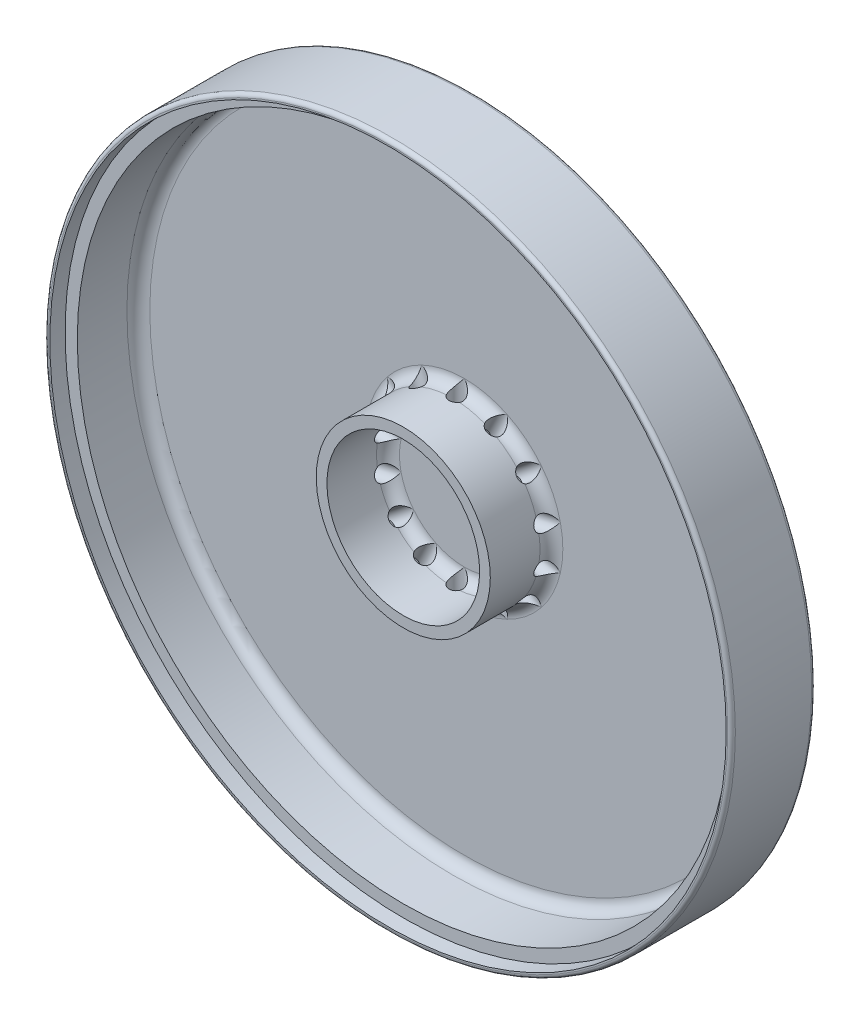
from build123d import *

# Parameters (mm, degrees)
SKETCH1_R                      = 90
SKETCH1_R_2                    = 88.6
SKETCH1_R_3                    = 85.4
SKETCH1_R_4                    = 22.8
SKETCH1_R_5                    = 20
BOSS_EXTRUDE1_DEPTH            = 2
BOSS_EXTRUDE2_START            = 20
SKETCH1_3_R                    = 90
SKETCH1_3_R_2                  = 88.6
BOSS_EXTRUDE2_DEPTH            = 20
BOSS_EXTRUDE3_START            = 16
SKETCH1_4_R                    = 88.6
SKETCH1_4_R_2                  = 85.4
BOSS_EXTRUDE3_DEPTH            = 16
SKETCH1_5_R                    = 22.8
SKETCH1_5_R_2                  = 20
BOSS_EXTRUDE4_DEPTH            = 16
CUT_EXTRUDE3_REACH             = 130.841
SKETCH2_R                      = 2
CUT_EXTRUDE3_DIRECTION_2_REACH = 130.841
FILLET1_R                      = 3
FILLET2_R                      = 3
FILLET3_R                      = 1
FILLET4_R                      = 1
CIRPATTERN1_COUNT              = 7


with BuildPart() as part:
    # Sketch1 → Boss-Extrude1 (new body)
    # profile 1 of 5: a face of its own
    with BuildSketch(Plane.XY):
        Circle(SKETCH1_R)
        Circle(SKETCH1_R_2, mode=Mode.SUBTRACT)
    # profile 2 of 5: a face of its own
    with BuildSketch(Plane.XY):
        Circle(SKETCH1_R_2)
        Circle(SKETCH1_R_3, mode=Mode.SUBTRACT)
    # profile 3 of 5: a face of its own
    with BuildSketch(Plane.XY):
        Circle(SKETCH1_R_3)
        Circle(SKETCH1_R_4, mode=Mode.SUBTRACT)
    # profile 4 of 5: a face of its own
    with BuildSketch(Plane.XY):
        Circle(SKETCH1_R_4)
        Circle(SKETCH1_R_5, mode=Mode.SUBTRACT)
    # profile 5 of 5: a face of its own
    with BuildSketch(Plane.XY):
        Circle(SKETCH1_R_5)
    extrude(amount=-BOSS_EXTRUDE1_DEPTH)

    # Sketch1<3> → Boss-Extrude2 (add)
    with BuildSketch(Plane.XY.offset(BOSS_EXTRUDE2_START)):
        Circle(SKETCH1_3_R)
        Circle(SKETCH1_3_R_2, mode=Mode.SUBTRACT)
    extrude(amount=-BOSS_EXTRUDE2_DEPTH)

    # Sketch1<4> → Boss-Extrude3 (add)
    with BuildSketch(Plane.XY.offset(BOSS_EXTRUDE3_START)):
        Circle(SKETCH1_4_R)
        Circle(SKETCH1_4_R_2, mode=Mode.SUBTRACT)
    extrude(amount=-BOSS_EXTRUDE3_DEPTH)

    # Sketch1<5> → Boss-Extrude4 (add)
    with BuildSketch(Plane.XY):
        Circle(SKETCH1_5_R)
        Circle(SKETCH1_5_R_2, mode=Mode.SUBTRACT)
    extrude(amount=BOSS_EXTRUDE4_DEPTH)

    # Sketch2 → Cut-Extrude3 (cut, up to next)
    with BuildSketch(Plane(origin=(0, 0, 0), x_dir=(1, 0, 0), z_dir=(0, 1, 0)), mode=Mode.PRIVATE) as cut_extrude3_sk1:
        with Locations(Location((0, -2, 0), (0, 0, 90))):
            Circle(SKETCH2_R)
    cut_extrude3_tool1 = extrude(cut_extrude3_sk1.sketch, amount=-CUT_EXTRUDE3_REACH, mode=Mode.PRIVATE) & part.part
    cut_extrude3 = cut_extrude3_tool1.solids().sort_by_distance((0, 0, 2))[0]
    add(cut_extrude3, mode=Mode.SUBTRACT)

    # Sketch2 → Cut-Extrude3 direction 2 (cut, up to next)
    with BuildSketch(Plane(origin=(0, 0, 0), x_dir=(1, 0, 0), z_dir=(0, 1, 0)), mode=Mode.PRIVATE) as cut_extrude3_direction_2_sk1:
        with Locations(Location((0, -2, 0), (0, 0, 90))):
            Circle(SKETCH2_R)
    cut_extrude3_direction_2_tool1 = extrude(cut_extrude3_direction_2_sk1.sketch, amount=CUT_EXTRUDE3_DIRECTION_2_REACH, mode=Mode.PRIVATE) & part.part
    cut_extrude3_direction_2 = cut_extrude3_direction_2_tool1.solids().sort_by_distance((0, 0, 2))[0]
    add(cut_extrude3_direction_2, mode=Mode.SUBTRACT)

    # Fillet1
    fillet1_edges = [part.edges().sort_by_distance(p)[0] for p in [
        (-85.4, 0, 0),
    ]]
    fillet(fillet1_edges, radius=FILLET1_R)

    # Fillet2
    # the kernel refuses this fillet: 3 mm, written as the material it adds along each edge
    with BuildSketch(Plane(origin=(0, 0, 0), x_dir=(1, 0, 0), z_dir=(0, -1, 0))) as fillet2_piece_1_section:
        with BuildLine():
            CenterArc((20 - FILLET2_R, FILLET2_R), FILLET2_R, 270, 90)
            Line((20 - FILLET2_R, 0), (20, 0))
            Line((20, 0), (20, FILLET2_R))
        make_face()
    fillet2_piece_1 = revolve(axis=Axis((0, 0, 0), (0, 0, 1)), revolution_arc=90, mode=Mode.PRIVATE)
    fillet2_piece_1 = fillet2_piece_1 - Plane(origin=(0, 13.541108847, 2), x_dir=(0, 0, -1), z_dir=(0, -1, 0)) * Cylinder(2, 80, mode=Mode.PRIVATE)
    add(fillet2_piece_1)
    with BuildSketch(Plane(origin=(0, 0, 0), x_dir=(0, 1, 0), z_dir=(1, 0, 0))) as fillet2_piece_2_section:
        with BuildLine():
            CenterArc((22.8 + FILLET2_R, FILLET2_R), FILLET2_R, 180, 90)
            Line((22.8, FILLET2_R), (22.8, 0))
            Line((22.8, 0), (22.8 + FILLET2_R, 0))
        make_face()
    fillet2_piece_2 = revolve(axis=Axis((0, 0, 0), (0, 0, 1)), revolution_arc=180, mode=Mode.PRIVATE)
    fillet2_piece_2 = fillet2_piece_2 - Plane(origin=(0, 0, 2), x_dir=(0, 0, -1), z_dir=(0, -1, 0)) * Cylinder(2, 104, mode=Mode.PRIVATE)
    add(fillet2_piece_2)
    with BuildSketch(Plane(origin=(0, 0, 0), x_dir=(0, 1, 0), z_dir=(1, 0, 0))) as fillet2_piece_3_section:
        with BuildLine():
            CenterArc((20 - FILLET2_R, FILLET2_R), FILLET2_R, 270, 90)
            Line((20 - FILLET2_R, 0), (20, 0))
            Line((20, 0), (20, FILLET2_R))
        make_face()
    fillet2_piece_3 = revolve(axis=Axis((0, 0, 0), (0, 0, 1)), revolution_arc=180, mode=Mode.PRIVATE)
    fillet2_piece_3 = fillet2_piece_3 - Plane(origin=(0, 0, 2), x_dir=(0, 0, -1), z_dir=(0, -1, 0)) * Cylinder(2, 80, mode=Mode.PRIVATE)
    add(fillet2_piece_3)
    with BuildSketch(Plane(origin=(0, 0, 0), x_dir=(0, -1, 0), z_dir=(-1, 0, 0))) as fillet2_piece_4_section:
        with BuildLine():
            CenterArc((22.8 + FILLET2_R, FILLET2_R), FILLET2_R, 180, 90)
            Line((22.8, FILLET2_R), (22.8, 0))
            Line((22.8, 0), (22.8 + FILLET2_R, 0))
        make_face()
    fillet2_piece_4 = revolve(axis=Axis((0, 0, 0), (0, 0, 1)), revolution_arc=90, mode=Mode.PRIVATE)
    fillet2_piece_4 = fillet2_piece_4 - Plane(origin=(0, -16.721645695, 2), x_dir=(0, 0, -1), z_dir=(0, 1, 0)) * Cylinder(2, 104, mode=Mode.PRIVATE)
    add(fillet2_piece_4)
    with BuildSketch(Plane(origin=(0, 0, 0), x_dir=(1, 0, 0), z_dir=(0, -1, 0))) as fillet2_piece_5_section:
        with BuildLine():
            CenterArc((22.8 + FILLET2_R, FILLET2_R), FILLET2_R, 180, 90)
            Line((22.8, FILLET2_R), (22.8, 0))
            Line((22.8, 0), (22.8 + FILLET2_R, 0))
        make_face()
    fillet2_piece_5 = revolve(axis=Axis((0, 0, 0), (0, 0, 1)), revolution_arc=90, mode=Mode.PRIVATE)
    fillet2_piece_5 = fillet2_piece_5 - Plane(origin=(0, 16.721645739, 2), x_dir=(0, 0, -1), z_dir=(0, -1, 0)) * Cylinder(2, 104, mode=Mode.PRIVATE)
    add(fillet2_piece_5)
    with BuildSketch(Plane(origin=(0, 0, 0), x_dir=(0, -1, 0), z_dir=(-1, 0, 0))) as fillet2_piece_6_section:
        with BuildLine():
            CenterArc((20 - FILLET2_R, FILLET2_R), FILLET2_R, 270, 90)
            Line((20 - FILLET2_R, 0), (20, 0))
            Line((20, 0), (20, FILLET2_R))
        make_face()
    fillet2_piece_6 = revolve(axis=Axis((0, 0, 0), (0, 0, 1)), revolution_arc=90, mode=Mode.PRIVATE)
    fillet2_piece_6 = fillet2_piece_6 - Plane(origin=(0, -13.541108804, 2), x_dir=(0, 0, -1), z_dir=(0, 1, 0)) * Cylinder(2, 80, mode=Mode.PRIVATE)
    add(fillet2_piece_6)

    # Fillet3
    fillet3_edges = [part.edges().sort_by_distance(p)[0] for p in [
        (-90, 0, -2),
    ]]
    fillet(fillet3_edges, radius=FILLET3_R)

    # Fillet4
    fillet4_edges = [part.edges().sort_by_distance(p)[0] for p in [
        (-90, 0, 20),
    ]]
    fillet(fillet4_edges, radius=FILLET4_R)

    # CirPattern1: Cut-Extrude3, Cut-Extrude3 direction 2; each copy of Cut-Extrude3, Cut-Extrude3 direction 2 runs up to whatever stops it at its own place
    cirpattern1_before = part.part  # the part as the pattern finds it: every copy runs up to it
    cirpattern1_cut_extrude3_long = extrude(cut_extrude3_sk1.sketch, amount=-CUT_EXTRUDE3_REACH, mode=Mode.PRIVATE)
    cirpattern1_cut_extrude3_tool1 = cirpattern1_cut_extrude3_long.rotate(Axis((0, 0, 16), (0, 0, -1)), 1 * 360 / CIRPATTERN1_COUNT) & cirpattern1_before
    add(cirpattern1_cut_extrude3_tool1.solids().sort_by_distance((0, 0, 2))[0], mode=Mode.SUBTRACT)
    cirpattern1_cut_extrude3_tool2 = cirpattern1_cut_extrude3_long.rotate(Axis((0, 0, 16), (0, 0, -1)), 2 * 360 / CIRPATTERN1_COUNT) & cirpattern1_before
    add(cirpattern1_cut_extrude3_tool2.solids().sort_by_distance((0, 0, 2))[0], mode=Mode.SUBTRACT)
    cirpattern1_cut_extrude3_tool3 = cirpattern1_cut_extrude3_long.rotate(Axis((0, 0, 16), (0, 0, -1)), 3 * 360 / CIRPATTERN1_COUNT) & cirpattern1_before
    add(cirpattern1_cut_extrude3_tool3.solids().sort_by_distance((0, 0, 2))[0], mode=Mode.SUBTRACT)
    cirpattern1_cut_extrude3_tool4 = cirpattern1_cut_extrude3_long.rotate(Axis((0, 0, 16), (0, 0, -1)), 4 * 360 / CIRPATTERN1_COUNT) & cirpattern1_before
    add(cirpattern1_cut_extrude3_tool4.solids().sort_by_distance((0, 0, 2))[0], mode=Mode.SUBTRACT)
    cirpattern1_cut_extrude3_tool5 = cirpattern1_cut_extrude3_long.rotate(Axis((0, 0, 16), (0, 0, -1)), 5 * 360 / CIRPATTERN1_COUNT) & cirpattern1_before
    add(cirpattern1_cut_extrude3_tool5.solids().sort_by_distance((0, 0, 2))[0], mode=Mode.SUBTRACT)
    cirpattern1_cut_extrude3_tool6 = cirpattern1_cut_extrude3_long.rotate(Axis((0, 0, 16), (0, 0, -1)), 6 * 360 / CIRPATTERN1_COUNT) & cirpattern1_before
    add(cirpattern1_cut_extrude3_tool6.solids().sort_by_distance((0, 0, 2))[0], mode=Mode.SUBTRACT)
    cirpattern1_cut_extrude3_direction_2_long = extrude(cut_extrude3_direction_2_sk1.sketch, amount=CUT_EXTRUDE3_DIRECTION_2_REACH, mode=Mode.PRIVATE)
    cirpattern1_cut_extrude3_direction_2_tool1 = cirpattern1_cut_extrude3_direction_2_long.rotate(Axis((0, 0, 16), (0, 0, -1)), 1 * 360 / CIRPATTERN1_COUNT) & cirpattern1_before
    add(cirpattern1_cut_extrude3_direction_2_tool1.solids().sort_by_distance((0, 0, 2))[0], mode=Mode.SUBTRACT)
    cirpattern1_cut_extrude3_direction_2_tool2 = cirpattern1_cut_extrude3_direction_2_long.rotate(Axis((0, 0, 16), (0, 0, -1)), 2 * 360 / CIRPATTERN1_COUNT) & cirpattern1_before
    add(cirpattern1_cut_extrude3_direction_2_tool2.solids().sort_by_distance((0, 0, 2))[0], mode=Mode.SUBTRACT)
    cirpattern1_cut_extrude3_direction_2_tool3 = cirpattern1_cut_extrude3_direction_2_long.rotate(Axis((0, 0, 16), (0, 0, -1)), 3 * 360 / CIRPATTERN1_COUNT) & cirpattern1_before
    add(cirpattern1_cut_extrude3_direction_2_tool3.solids().sort_by_distance((0, 0, 2))[0], mode=Mode.SUBTRACT)
    cirpattern1_cut_extrude3_direction_2_tool4 = cirpattern1_cut_extrude3_direction_2_long.rotate(Axis((0, 0, 16), (0, 0, -1)), 4 * 360 / CIRPATTERN1_COUNT) & cirpattern1_before
    add(cirpattern1_cut_extrude3_direction_2_tool4.solids().sort_by_distance((0, 0, 2))[0], mode=Mode.SUBTRACT)
    cirpattern1_cut_extrude3_direction_2_tool5 = cirpattern1_cut_extrude3_direction_2_long.rotate(Axis((0, 0, 16), (0, 0, -1)), 5 * 360 / CIRPATTERN1_COUNT) & cirpattern1_before
    add(cirpattern1_cut_extrude3_direction_2_tool5.solids().sort_by_distance((0, 0, 2))[0], mode=Mode.SUBTRACT)
    cirpattern1_cut_extrude3_direction_2_tool6 = cirpattern1_cut_extrude3_direction_2_long.rotate(Axis((0, 0, 16), (0, 0, -1)), 6 * 360 / CIRPATTERN1_COUNT) & cirpattern1_before
    add(cirpattern1_cut_extrude3_direction_2_tool6.solids().sort_by_distance((0, 0, 2))[0], mode=Mode.SUBTRACT)


solid = part.part
